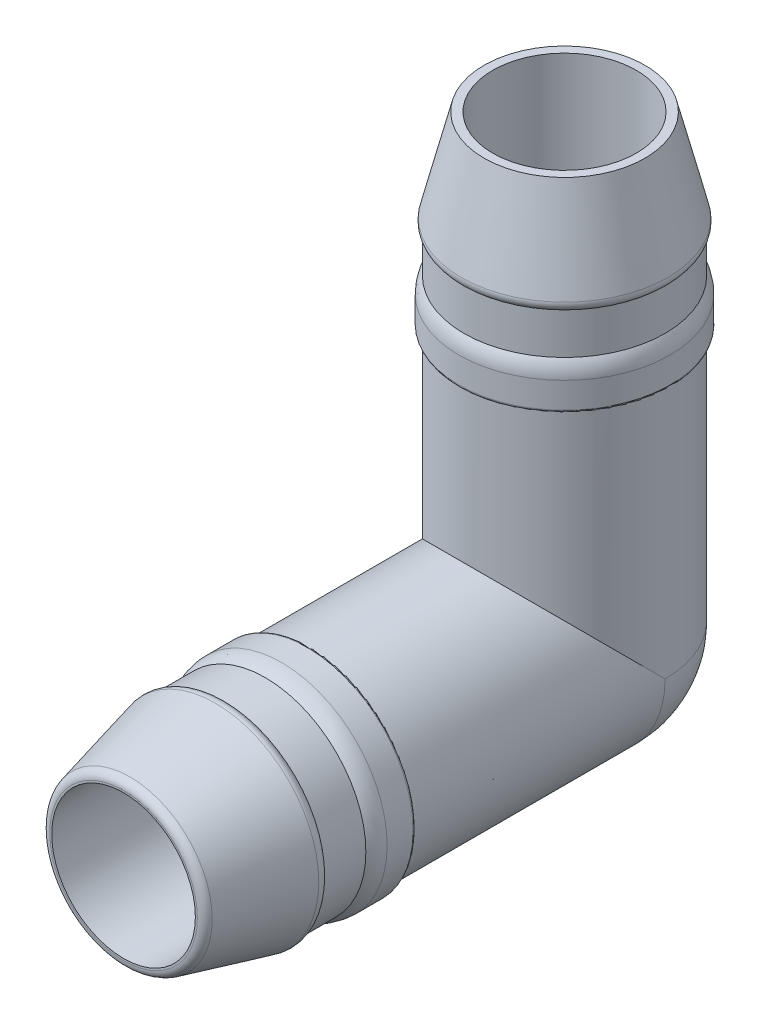
from build123d import *

# Parameters (mm, degrees)
SKETCH1_R                       = 3.5
BOSS_EXTRUDE1_DEPTH             = 8.85
SKETCH2_R                       = 3.675
BOSS_EXTRUDE2_DEPTH             = 2
FILLET1_R                       = 1
SKETCH4_R                       = 3.5
BOSS_EXTRUDE3_DEPTH             = 1
BOSS_EXTRUDE3_DIRECTION_2_REACH = 14.031
SKETCH5_R                       = 3.675
BOSS_EXTRUDE4_DEPTH             = 3.5
BOSS_EXTRUDE4_TAPER             = 14
FILLET2_R                       = 0.3
FILLET3_R                       = 0.1
SKETCH7_R                       = 3.5
BOSS_EXTRUDE5_DEPTH             = 8.85
SKETCH8_R                       = 3.675
BOSS_EXTRUDE6_DEPTH             = 2
FILLET4_R                       = 1
SKETCH9_R                       = 3.5
BOSS_EXTRUDE7_DEPTH             = 1
BOSS_EXTRUDE7_DIRECTION_2_REACH = 23.45
SKETCH10_R                      = 3.675
BOSS_EXTRUDE8_DEPTH             = 3.5
BOSS_EXTRUDE8_TAPER             = 14
REVOLVE1_ANGLE                  = 90
FILLET5_R                       = 0.3
FILLET6_R                       = 0.1
SKETCH13_R                      = 2.5


with BuildPart() as part:
    # Sketch1 → Boss-Extrude1 (new body)
    with BuildSketch(Plane.XY):
        Circle(SKETCH1_R)
    extrude(amount=BOSS_EXTRUDE1_DEPTH)

    # Sketch2 → Boss-Extrude2 (add)
    with BuildSketch(Plane.XY.offset(8.85)):
        Circle(SKETCH2_R)
    extrude(amount=BOSS_EXTRUDE2_DEPTH)

    # Fillet1
    fillet1_edges = [part.edges().sort_by_distance(p)[0] for p in [
        (-3.675, 0, 10.85),
    ]]
    fillet(fillet1_edges, radius=FILLET1_R)

    # Sketch4 → Boss-Extrude3 (add)
    with BuildSketch(Plane.XY.offset(10.85)):
        Circle(SKETCH4_R)
    extrude(amount=BOSS_EXTRUDE3_DEPTH)

    # Sketch4 → Boss-Extrude3 direction 2 (add, up to next)
    with BuildSketch(Plane.XY.offset(10.85), mode=Mode.PRIVATE) as boss_extrude3_direction_2_sk1:
        Circle(SKETCH4_R)
    boss_extrude3_direction_2_tool1 = extrude(boss_extrude3_direction_2_sk1.sketch, amount=-BOSS_EXTRUDE3_DIRECTION_2_REACH, mode=Mode.PRIVATE) - part.part
    add(boss_extrude3_direction_2_tool1.solids().sort_by_distance((0, 0, 10.85))[0])

    # Sketch5 → Boss-Extrude4 (add)
    with BuildSketch(Plane.XY.offset(11.85)):
        Circle(SKETCH5_R)
    extrude(amount=BOSS_EXTRUDE4_DEPTH, taper=BOSS_EXTRUDE4_TAPER)

    # Fillet2
    # the kernel refuses this fillet: 0.3 mm, written as the material it takes off along each edge
    with BuildSketch(Plane(origin=(0, 0, 11.85), x_dir=(1, 0, 0), z_dir=(0, 1, 0))) as fillet2_piece_1:
        with BuildLine():
            CenterArc((3.308283827, -0.230748584), FILLET2_R, 346, 64.278692047)
            Line((3.599372545, -0.303325153), (3.60519432, -0.304776684))
            Line((3.60519432, -0.304776684), (3.680821774, -0.001451531))
            Line((3.680821774, -0.001451531), (3.675, 0.006))
            ThreePointArc((3.675, 0.006), (3.5875, 0.006), (3.503834323, 0.004614972))
            Line((3.503834323, 0.004614972), (3.5, 0))
        make_face()
    revolve(axis=Axis((0, 0, 11.85), (0, 0, -1)), mode=Mode.SUBTRACT)
    with BuildSketch(Plane(origin=(0, 0, 15.35), x_dir=(1, 0, 0), z_dir=(0, 1, 0))) as fillet2_piece_2:
        with BuildLine():
            CenterArc((2.80235199 - FILLET2_R * 0.781285626507, FILLET2_R), FILLET2_R, 270, 76)
            Line((2.80235199 - FILLET2_R * 0.781285626507, 0), (2.80235199 - FILLET2_R * 0.781285626507, -FILLET2_R * 0.02))
            Line((2.80235199 - FILLET2_R * 0.781285626507, -FILLET2_R * 0.02), (2.80235199 + FILLET2_R * 0.0156257125301, -FILLET2_R * 0.02))
            Line((2.80235199 + FILLET2_R * 0.0156257125301, -FILLET2_R * 0.02), (2.80235199 + FILLET2_R * 0.208416014295, FILLET2_R * 0.753239666488))
            Line((2.80235199 + FILLET2_R * 0.208416014295, FILLET2_R * 0.753239666488), (2.80235199 + FILLET2_R * 0.189010099769, FILLET2_R * 0.7580781044))
        make_face()
    revolve(axis=Axis((0, 0, 15.35), (0, 0, -1)), mode=Mode.SUBTRACT)

    # Fillet3
    fillet3_edges = [part.edges().sort_by_distance(p)[0] for p in [
        (-3.675, 0, 8.85),
    ]]
    fillet(fillet3_edges, radius=FILLET3_R)

    # Sketch7 → Boss-Extrude5 (add)
    with BuildSketch(Plane(origin=(0, 0, 0), x_dir=(1, 0, 0), z_dir=(0, 1, 0))):
        with Locations(Location((0, 0, 0), (0, 0, 180))):
            Circle(SKETCH7_R)
    extrude(amount=BOSS_EXTRUDE5_DEPTH)

    # Sketch8 → Boss-Extrude6 (add)
    with BuildSketch(Plane(origin=(0, 8.85, 0), x_dir=(1, 0, 0), z_dir=(0, 1, 0))):
        with Locations(Location((0, 0, 0), (0, 0, 270))):
            Circle(SKETCH8_R)
    extrude(amount=BOSS_EXTRUDE6_DEPTH)

    # Fillet4
    fillet4_edges = [part.edges().sort_by_distance(p)[0] for p in [
        (0, 10.85, -3.675),
    ]]
    fillet(fillet4_edges, radius=FILLET4_R)

    # Sketch9 → Boss-Extrude7 (add)
    with BuildSketch(Plane(origin=(0, 10.85, 0), x_dir=(1, 0, 0), z_dir=(0, 1, 0))):
        with Locations(Location((0, 0, 0), (0, 0, 180))):
            Circle(SKETCH9_R)
    extrude(amount=BOSS_EXTRUDE7_DEPTH)

    # Sketch9 → Boss-Extrude7 direction 2 (add, up to next)
    with BuildSketch(Plane(origin=(0, 10.85, 0), x_dir=(1, 0, 0), z_dir=(0, 1, 0)), mode=Mode.PRIVATE) as boss_extrude7_direction_2_sk1:
        with Locations(Location((0, 0, 0), (0, 0, 180))):
            Circle(SKETCH9_R)
    boss_extrude7_direction_2_tool1 = extrude(boss_extrude7_direction_2_sk1.sketch, amount=-BOSS_EXTRUDE7_DIRECTION_2_REACH, mode=Mode.PRIVATE) - part.part
    add(boss_extrude7_direction_2_tool1.solids().sort_by_distance((0, 10.85, 0))[0])

    # Sketch10 → Boss-Extrude8 (add)
    with BuildSketch(Plane(origin=(0, 11.85, 0), x_dir=(1, 0, 0), z_dir=(0, 1, 0))):
        with Locations(Location((0, 0, 0), (0, 0, 270))):
            Circle(SKETCH10_R)
    extrude(amount=BOSS_EXTRUDE8_DEPTH, taper=BOSS_EXTRUDE8_TAPER)

    # Sketch15 → Revolve1 (revolve)
    with BuildSketch(Plane(origin=(0, 0, 0), x_dir=(-1, 0, 0), z_dir=(0, 0, -1))):
        with BuildLine():
            Line((-3.5, 0), (3.5, 0))
            ThreePointArc((3.5, 0), (0, -3.5), (-3.5, 0))
        make_face()
    revolve(axis=Axis((3.5, 0, 0), (1, 0, 0)), revolution_arc=REVOLVE1_ANGLE)

    # Fillet5
    # the kernel refuses this fillet: 0.3 mm, written as the material it takes off along each edge
    with BuildSketch(Plane(origin=(0, 11.85, 0), x_dir=(0, 0, 1), z_dir=(-1, 0, 0))) as fillet5_piece_1:
        with BuildLine():
            CenterArc((3.308283827, 0.230748584), FILLET5_R, 309.721307953, 64.278692047)
            Line((3.5, 0), (3.503834323, -0.004614972))
            ThreePointArc((3.503834323, -0.004614972), (3.5875, -0.006), (3.675, -0.006))
            Line((3.675, -0.006), (3.680821774, 0.001451531))
            Line((3.680821774, 0.001451531), (3.60519432, 0.304776684))
            Line((3.60519432, 0.304776684), (3.599372545, 0.303325153))
        make_face()
    revolve(axis=Axis((0, 11.85, 0), (0, 1, 0)), mode=Mode.SUBTRACT)

    # Fillet6
    fillet6_edges = [part.edges().sort_by_distance(p)[0] for p in [
        (0, 8.85, -3.675),
    ]]
    fillet(fillet6_edges, radius=FILLET6_R)

    # Cut-Sweep2: sweep along a path in Sketch19
    with BuildLine(Plane(origin=(0, 0, 0), x_dir=(0, 0, -1), z_dir=(1, 0, 0))) as cut_sweep2_path:
        Line((-15.35, 0), (-3.5, 0))
        ThreePointArc((-3.5, 0), (-1.025126266, 1.025126266), (0, 3.5))
        Line((0, 3.5), (0, 16.174677612))
    # Sketch13 → Cut-Sweep2 (sweep, cut)
    with BuildSketch(Plane.XY.offset(15.35)):
        Circle(SKETCH13_R)
    sweep(path=cut_sweep2_path.line, mode=Mode.SUBTRACT)


solid = part.part
